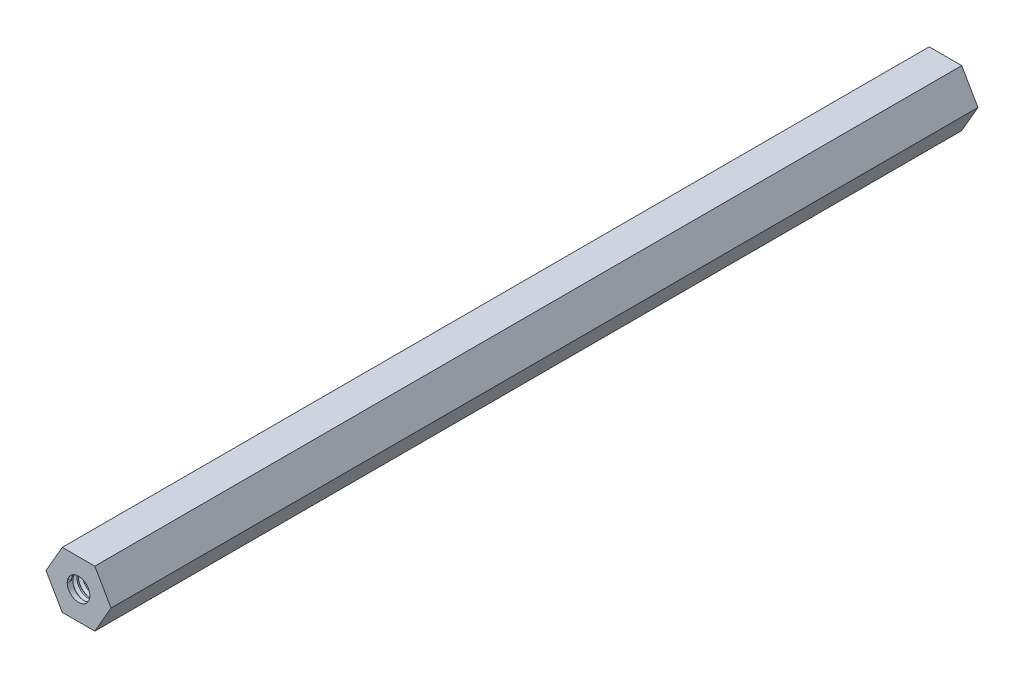
from build123d import *
from build123d.topology import SkipClean

# Parameters (mm, degrees)
EXTRUSI_N_HEX_PROFILE_DEPTH = 97.703150034
TAP_START                   = 97.70315
CROQUIS3_R                  = 2.5527
TAP_HOLE_1_DEPTH            = 19.05
TAP_START_2                 = -78.65315
CROQUIS3_3_R                = 2.5527
TAP_HOLE_2_DEPTH            = 19.05
ROSCA1_PITCH                = 1.27
ROSCA2_PITCH                = 1.27


with BuildPart() as part:
    # Croquis2 → Extrusión Hex Profile (new, symmetric)
    with BuildSketch(Plane.XY):
        Polygon((3.666174209, -6.35), (7.332348419, 0), (3.666174209, 6.35), (-3.666174209, 6.35), (-7.332348419, 0), (-3.666174209, -6.35), align=None)
    extrude(amount=EXTRUSI_N_HEX_PROFILE_DEPTH, both=True)

    # Croquis3 → Tap Hole 1 (cut)
    with BuildSketch(Plane.XY.offset(TAP_START)):
        Circle(CROQUIS3_R)
    extrude(amount=-TAP_HOLE_1_DEPTH, mode=Mode.SUBTRACT)

    # Croquis3<3> → Tap Hole 2 (cut)
    with BuildSketch(Plane.XY.offset(TAP_START_2)):
        Circle(CROQUIS3_3_R)
    extrude(amount=-TAP_HOLE_2_DEPTH, mode=Mode.SUBTRACT)

    # Rosca1: the profile of Perfil de rosca1 profile screwed along a right-hand helix of 15 turns, 8 arcs to a turn; built about Z, then put on its axis
    with SkipClean():  # the faces are left unmerged after this step: merging them gives an invalid solid
        rosca1_z = Axis((0, 0, 0), (0, 0, 1))
        rosca1_corners = [(2.5524, 0, -0.000173205), (3.240107661, 0, 0.396874998), (3.240107661, 0, 0.555624998), (2.5524, 0, 0.952673202)]
        with BuildLine(mode=Mode.PRIVATE) as rosca1_profile:
            Line(rosca1_corners[0], rosca1_corners[1])
            Line(rosca1_corners[1], rosca1_corners[2])
            Line(rosca1_corners[2], rosca1_corners[3])
            Line(rosca1_corners[3], rosca1_corners[0])
        rosca1_cap = Face(rosca1_profile.wire())
        rosca1_turn_angles = [0, 22.5, 45, 67.5, 90, 112.5, 135, 157.5, 180, 202.5, 225, 247.5, 270, 292.5, 315, 337.5, 360]
        rosca1_turn_weights = [1, 0.9238795325112867, 1, 0.9238795325112867, 1, 0.9238795325112867, 1, 0.9238795325112867, 1, 0.9238795325112867, 1, 0.9238795325112867, 1, 0.9238795325112867, 1, 0.9238795325112867, 1]
        rosca1_turn_rails = [Edge.make_bspline([Vector(p[0], p[1], 0).rotate(rosca1_z, rosca1_turn_angles[k]) / rosca1_turn_weights[k] + Vector(0, 0, p[2] + ROSCA1_PITCH * rosca1_turn_angles[k] / 360) for k in range(17)], [0, 0, 0, 1, 1, 2, 2, 3, 3, 4, 4, 5, 5, 6, 6, 7, 7, 8, 8, 8], 2, rosca1_turn_weights) for p in rosca1_corners]
        rosca1_turn_sides = [Face.make_surface_from_curves(rosca1_turn_rails[p[0]], rosca1_turn_rails[p[1]]) for p in [(0, 1), (1, 2), (2, 3), (3, 0)]]
        rosca1 = Plane(origin=(0, 0, 97.703150034), x_dir=(-1, 0, 0), z_dir=(0, 0, -1)) * Solid(Shell([*[p.moved(Location((0, 0, ROSCA1_PITCH * i))) for i in range(15) for p in rosca1_turn_sides], rosca1_cap, rosca1_cap.rotate(rosca1_z, 5400).moved(Location((0, 0, ROSCA1_PITCH * 5400 / 360)))]))
        add(rosca1, mode=Mode.SUBTRACT)

    # Rosca2: the profile of Perfil de rosca2 profile screwed along a right-hand helix of 15 turns, 8 arcs to a turn; built about Z, then put on its axis
    with SkipClean():  # the faces are left unmerged after this step: merging them gives an invalid solid
        rosca2_z = Axis((0, 0, 0), (0, 0, 1))
        rosca2_corners = [(2.5524, 0, -0.000173205), (3.240107661, 0, 0.396874998), (3.240107661, 0, 0.555624998), (2.5524, 0, 0.952673202)]
        with BuildLine(mode=Mode.PRIVATE) as rosca2_profile:
            Line(rosca2_corners[0], rosca2_corners[1])
            Line(rosca2_corners[1], rosca2_corners[2])
            Line(rosca2_corners[2], rosca2_corners[3])
            Line(rosca2_corners[3], rosca2_corners[0])
        rosca2_cap = Face(rosca2_profile.wire())
        rosca2_turn_angles = [0, 22.5, 45, 67.5, 90, 112.5, 135, 157.5, 180, 202.5, 225, 247.5, 270, 292.5, 315, 337.5, 360]
        rosca2_turn_weights = [1, 0.9238795325112867, 1, 0.9238795325112867, 1, 0.9238795325112867, 1, 0.9238795325112867, 1, 0.9238795325112867, 1, 0.9238795325112867, 1, 0.9238795325112867, 1, 0.9238795325112867, 1]
        rosca2_turn_rails = [Edge.make_bspline([Vector(p[0], p[1], 0).rotate(rosca2_z, rosca2_turn_angles[k]) / rosca2_turn_weights[k] + Vector(0, 0, p[2] + ROSCA2_PITCH * rosca2_turn_angles[k] / 360) for k in range(17)], [0, 0, 0, 1, 1, 2, 2, 3, 3, 4, 4, 5, 5, 6, 6, 7, 7, 8, 8, 8], 2, rosca2_turn_weights) for p in rosca2_corners]
        rosca2_turn_sides = [Face.make_surface_from_curves(rosca2_turn_rails[p[0]], rosca2_turn_rails[p[1]]) for p in [(0, 1), (1, 2), (2, 3), (3, 0)]]
        rosca2 = Plane(origin=(0, 0, -97.703150034), x_dir=(1, 0, 0), z_dir=(0, 0, 1)) * Solid(Shell([*[p.moved(Location((0, 0, ROSCA2_PITCH * i))) for i in range(15) for p in rosca2_turn_sides], rosca2_cap, rosca2_cap.rotate(rosca2_z, 5400).moved(Location((0, 0, ROSCA2_PITCH * 5400 / 360)))]))
        add(rosca2, mode=Mode.SUBTRACT)


solid = part.part
